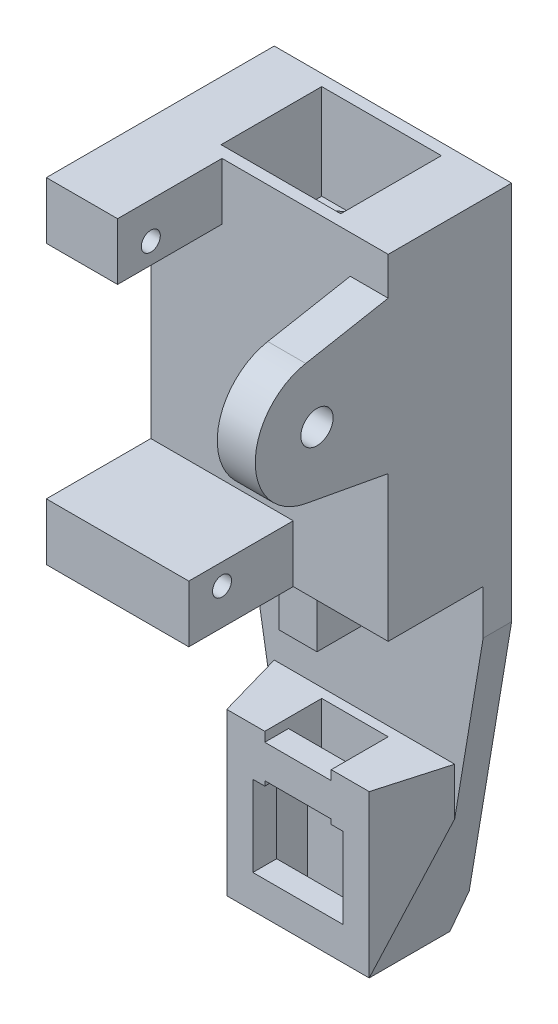
from build123d import *
from OCP.BRepFilletAPI import BRepFilletAPI_MakeChamfer

# Parameters (mm, degrees)
RESSALTO_EXTRUS_O1_DEPTH = 13
ESBO_O2_W                = 15
ESBO_O2_H                = 6
ESBO_O2_W_2              = 4
ESBO_O2_H_2              = 16
RESSALTO_EXTRUS_O2_DEPTH = 15
ESBO_O3_R                = 1
CORTE_EXTRUS_O1_DEPTH    = 77.870020164
ESBO_O10_R               = 1.7
CORTE_EXTRUS_O4_DEPTH    = 10
ESBO_O11_W               = 25
ESBO_O11_H               = 34.7
CORTE_EXTRUS_O5_DEPTH    = 10
RESSALTO_EXTRUS_O3_DEPTH = 17
RESSALTO_EXTRUS_O4_REACH = 77.374
ESBO_O7_W                = 4
ESBO_O7_H                = 5
ESBO_O8_W                = 15
ESBO_O8_H                = 3.5
RESSALTO_EXTRUS_O5_DEPTH = 2.5
CHANFRO2_SIZE            = 2
CHANFRO2_SIZE_2          = 7
CHANFRO3_SIZE            = 1.5
CHANFRO3_SIZE2           = 3.216760381
ESBO_O12_W               = 12.6
ESBO_O12_H               = 10.6
CORTE_EXTRUS_O6_DEPTH    = 10
CORTE_EXTRUS_O7_DEPTH    = 22
ESBO_O15_R               = 2
CORTE_EXTRUS_O9_DEPTH    = 15
ESBO_O17_W               = 15
ESBO_O17_H               = 35.3
CORTE_EXTRUS_O10_DEPTH   = 4
ESBO_O18_W               = 7.5
ESBO_O18_H               = 6
CORTE_EXTRUS_O11_DEPTH   = 11


with BuildPart() as part:
    # Esboço1 → Ressalto-extrusão1 (new body)
    with BuildSketch(Plane.XY):
        Polygon((-12.5, 0), (12.5, 0), (12.5, -40), (7.5, -70), (-7.5, -70), (-12.5, -40), align=None)
    extrude(amount=RESSALTO_EXTRUS_O1_DEPTH)

    # Esboço2 → Ressalto-extrusão2 (add)
    with BuildSketch(Plane.XY.offset(13)):
        with Locations((-5, -32.3)):
            Rectangle(ESBO_O2_W, ESBO_O2_H)
        with Locations((-5, -3)):
            Rectangle(ESBO_O2_W, ESBO_O2_H)
        with Locations((10.5, -12)):
            Rectangle(ESBO_O2_W_2, ESBO_O2_H_2)
    extrude(amount=RESSALTO_EXTRUS_O2_DEPTH)

    # Esboço3 → Corte-extrusão1 (cut, through all)
    with BuildSketch(Plane(origin=(2.5, 0, 0), x_dir=(0, 0, -1), z_dir=(1, 0, 0))):
        with Locations(Location((-20.5, -3.8, 0), (0, 0, 90))):
            Circle(ESBO_O3_R)
        with Locations(Location((-20.5, -31.5, 0), (0, 0, 270))):
            Circle(ESBO_O3_R)
    extrude(amount=-CORTE_EXTRUS_O1_DEPTH, mode=Mode.SUBTRACT)

    # Esboço10 → Corte-extrusão4 (cut)
    with BuildSketch(Plane(origin=(12.5, 0, 0), x_dir=(0, 0, -1), z_dir=(1, 0, 0))):
        with Locations((-20.5, -12)):
            Circle(ESBO_O10_R)
        with BuildLine():
            Line((-13, -4), (-28, -4))
            Line((-28, -4), (-28, -20))
            Line((-28, -20), (-13, -20))
            Line((-13, -20), (-21.684004699, -18.391254405))
            ThreePointArc((-21.684004699, -18.391254405), (-27, -12), (-21.684004699, -5.608745595))
            Line((-21.684004699, -5.608745595), (-13, -4))
        make_face()
    extrude(amount=-CORTE_EXTRUS_O4_DEPTH, mode=Mode.SUBTRACT)

    # Esboço11 → Corte-extrusão5 (cut)
    with BuildSketch(Plane.XY.offset(13)):
        with Locations((0, -52.65)):
            Rectangle(ESBO_O11_W, ESBO_O11_H)
    extrude(amount=-CORTE_EXTRUS_O5_DEPTH, mode=Mode.SUBTRACT)

    # Esboço6 → Ressalto-extrusão3 (add)
    with BuildSketch(Plane.XZ.offset(70)):
        Polygon((-5, 4), (-5, 7.5), (-4.75, 7.5), (-4.75, 10), (-7.5, 10), (-7.5, 3), (7.5, 3), (7.5, 10), (4.75, 10), (4.75, 7.5), (5, 7.5), (5, 4), align=None)
    extrude(amount=-RESSALTO_EXTRUS_O3_DEPTH)

    # Ressalto-extrusão4: up to this face of the body (flat: up to its plane)
    ressalto_extrus_o4_end = Plane(part.part.faces().sort_by_distance((-6.125, -61.5, 10))[0])
    # Esboço7 → Ressalto-extrusão4 (add, up to the picked face)
    with BuildSketch(Plane.XY.offset(3), mode=Mode.PRIVATE) as ressalto_extrus_o4_sk1:
        with Locations((0, -40.5)):
            Rectangle(ESBO_O7_W, ESBO_O7_H)
    ressalto_extrus_o4_tool1 = split(extrude(ressalto_extrus_o4_sk1.sketch, amount=RESSALTO_EXTRUS_O4_REACH, mode=Mode.PRIVATE), bisect_by=ressalto_extrus_o4_end, keep=Keep.BOTH, mode=Mode.PRIVATE)
    # Esboço7 → Ressalto-extrusão4 (add, up to the picked face)
    with BuildSketch(Plane.XY.offset(3), mode=Mode.PRIVATE) as ressalto_extrus_o4_sk2:
        with Locations((5.5, -55.5)):
            Rectangle(ESBO_O7_W, ESBO_O7_H)
    ressalto_extrus_o4_tool2 = split(extrude(ressalto_extrus_o4_sk2.sketch, amount=RESSALTO_EXTRUS_O4_REACH, mode=Mode.PRIVATE), bisect_by=ressalto_extrus_o4_end, keep=Keep.BOTH, mode=Mode.PRIVATE)
    # Esboço7 → Ressalto-extrusão4 (add, up to the picked face)
    with BuildSketch(Plane.XY.offset(3), mode=Mode.PRIVATE) as ressalto_extrus_o4_sk3:
        with Locations((-5.5, -55.5)):
            Rectangle(ESBO_O7_W, ESBO_O7_H)
    ressalto_extrus_o4_tool3 = split(extrude(ressalto_extrus_o4_sk3.sketch, amount=RESSALTO_EXTRUS_O4_REACH, mode=Mode.PRIVATE), bisect_by=ressalto_extrus_o4_end, keep=Keep.BOTH, mode=Mode.PRIVATE)
    add(ressalto_extrus_o4_tool1.solids().sort_by(Axis((0, -40.5, 3), (0, 0, 1)))[0])
    add(ressalto_extrus_o4_tool2.solids().sort_by(Axis((5.5, -55.5, 3), (0, 0, 1)))[0])
    add(ressalto_extrus_o4_tool3.solids().sort_by(Axis((-5.5, -55.5, 3), (0, 0, 1)))[0])

    # Esboço8 → Ressalto-extrusão5 (add)
    with BuildSketch(Plane.XY.offset(10)):
        with Locations((0, -68.25)):
            Rectangle(ESBO_O8_W, ESBO_O8_H)
        with Locations((0, -55.75)):
            Rectangle(ESBO_O8_W, ESBO_O8_H)
    extrude(amount=-RESSALTO_EXTRUS_O5_DEPTH)

    # Chanfro2
    chanfro2_edges_1 = [part.edges().sort_by_distance(p)[0] for p in [
        (7.5, -61.5, 3),
    ]]
    chanfro2_side_1 = [part.faces().sort_by_distance(p)[0] for p in [
        (7.54, -61.5, 3),
    ]]
    chanfro2_edges_2 = [part.edges().sort_by_distance(p)[0] for p in [
        (-7.5, -61.5, 3),
    ]]
    chanfro2_side_2 = [part.faces().sort_by_distance(p)[0] for p in [
        (-7.54, -61.5, 3),
    ]]
    chanfro2 = BRepFilletAPI_MakeChamfer(part.part.solid().wrapped)
    for e in chanfro2_edges_1:
        chanfro2.Add(CHANFRO2_SIZE - 0.0001, CHANFRO2_SIZE_2 - 0.0001, e.wrapped, chanfro2_side_1[0].wrapped)
    for e in chanfro2_edges_2:
        chanfro2.Add(CHANFRO2_SIZE - 0.0001, CHANFRO2_SIZE_2 - 0.0001, e.wrapped, chanfro2_side_2[0].wrapped)
    add(Compound.cast(chanfro2.Shape()), mode=Mode.REPLACE)  # a hair under: the kernel refuses the full size

    # Chanfro3
    chanfro3_edges = [part.edges().sort_by_distance(p)[0] for p in [
        (0, -70, 0),
    ]]
    chanfro3_side = [part.faces().sort_by_distance(p)[0] for p in [
        (7.319722436, -70, 9.99995),
    ]]
    chamfer(chanfro3_edges, length=CHANFRO3_SIZE, length2=CHANFRO3_SIZE2, reference=chanfro3_side[0])

    # Esboço12 → Corte-extrusão6 (cut)
    with BuildSketch(Plane(origin=(0, 0, 0), x_dir=(1, 0, 0), z_dir=(0, 1, 0))):
        with Locations((0, -6.5)):
            Rectangle(ESBO_O12_W, ESBO_O12_H)
    extrude(amount=-CORTE_EXTRUS_O6_DEPTH, mode=Mode.SUBTRACT)

    # Esboço13 → Corte-extrusão7 (cut)
    with BuildSketch(Plane(origin=(0, -10, 0), x_dir=(1, 0, 0), z_dir=(0, 1, 0))):
        with BuildLine():
            Line((-3.405877273, -11.8), (3.405877273, -11.8))
            ThreePointArc((3.405877273, -11.8), (6.3, -6.5), (3.405877273, -1.2))
            Line((3.405877273, -1.2), (-3.405877273, -1.2))
            ThreePointArc((-3.405877273, -1.2), (-6.3, -6.5), (-3.405877273, -11.8))
        make_face()
    extrude(amount=-CORTE_EXTRUS_O7_DEPTH, mode=Mode.SUBTRACT)

    # Esboço15 → Corte-extrusão9 (cut)
    with BuildSketch(Plane.ZY.offset(12.5)):
        with Locations((6, -28)):
            Circle(ESBO_O15_R)
    extrude(amount=-CORTE_EXTRUS_O9_DEPTH, mode=Mode.SUBTRACT)

    # Esboço17 → Corte-extrusão10 (cut)
    with BuildSketch(Plane.XY.offset(28)):
        with Locations((-5, -17.65)):
            Rectangle(ESBO_O17_W, ESBO_O17_H)
    extrude(amount=-CORTE_EXTRUS_O10_DEPTH, mode=Mode.SUBTRACT)

    # Esboço18 → Corte-extrusão11 (cut)
    with BuildSketch(Plane.XY.offset(24)):
        with Locations((-1.25, -3)):
            Rectangle(ESBO_O18_W, ESBO_O18_H)
    extrude(amount=-CORTE_EXTRUS_O11_DEPTH, mode=Mode.SUBTRACT)


solid = part.part
